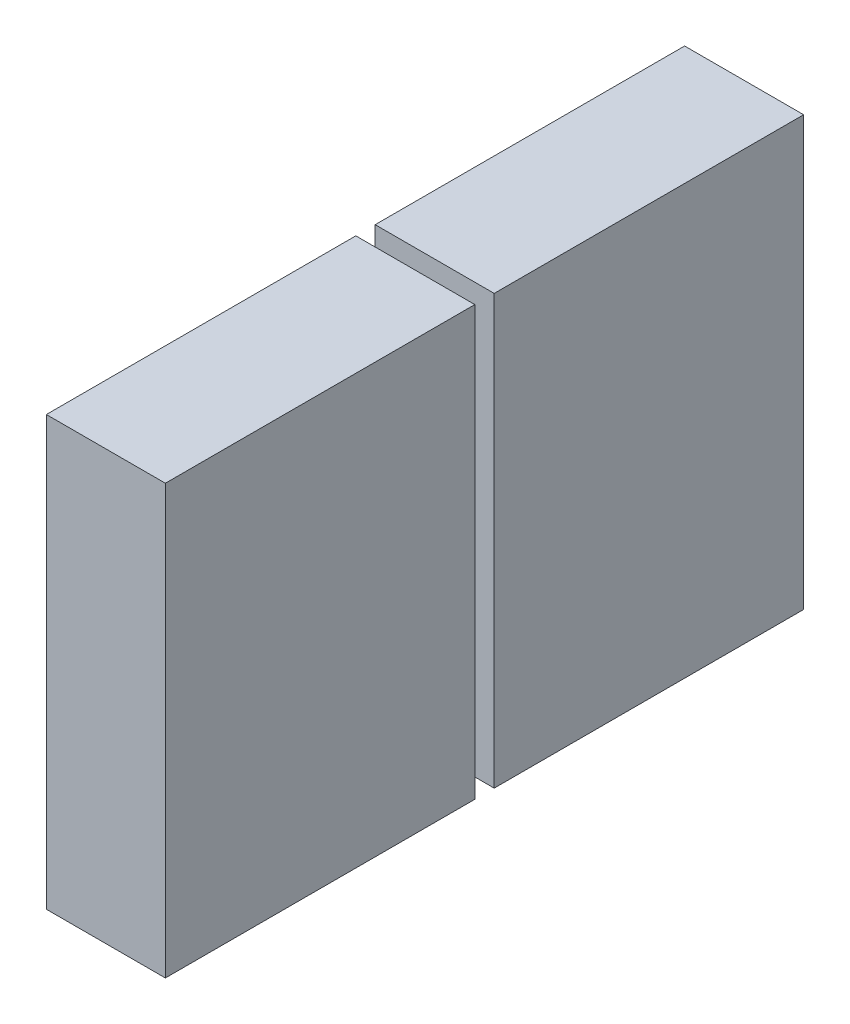
from build123d import *

# Parameters (mm, degrees)
SKETCH2_W             = 125
SKETCH2_H             = 325
BOSS_EXTRUDE1_DEPTH   = 450
BOSS_EXTRUDE1_2_DEPTH = 450


with BuildPart() as part:
    # Sketch2 → Boss-Extrude1 (new body)
    with BuildSketch(Plane(origin=(0, 0, 0), x_dir=(1, 0, 0), z_dir=(0, 1, 0))):
        with Locations((301.26, -172.66)):
            Rectangle(SKETCH2_W, SKETCH2_H)
    extrude(amount=BOSS_EXTRUDE1_DEPTH)


with BuildPart() as body_2:
    # Sketch2 → Boss-Extrude1 2 (new body)
    with BuildSketch(Plane(origin=(0, 0, 0), x_dir=(1, 0, 0), z_dir=(0, 1, 0))):
        with Locations((301.26, 172.66)):
            Rectangle(SKETCH2_W, SKETCH2_H)
    extrude(amount=BOSS_EXTRUDE1_2_DEPTH)


solid = Compound([part.part, body_2.part])
